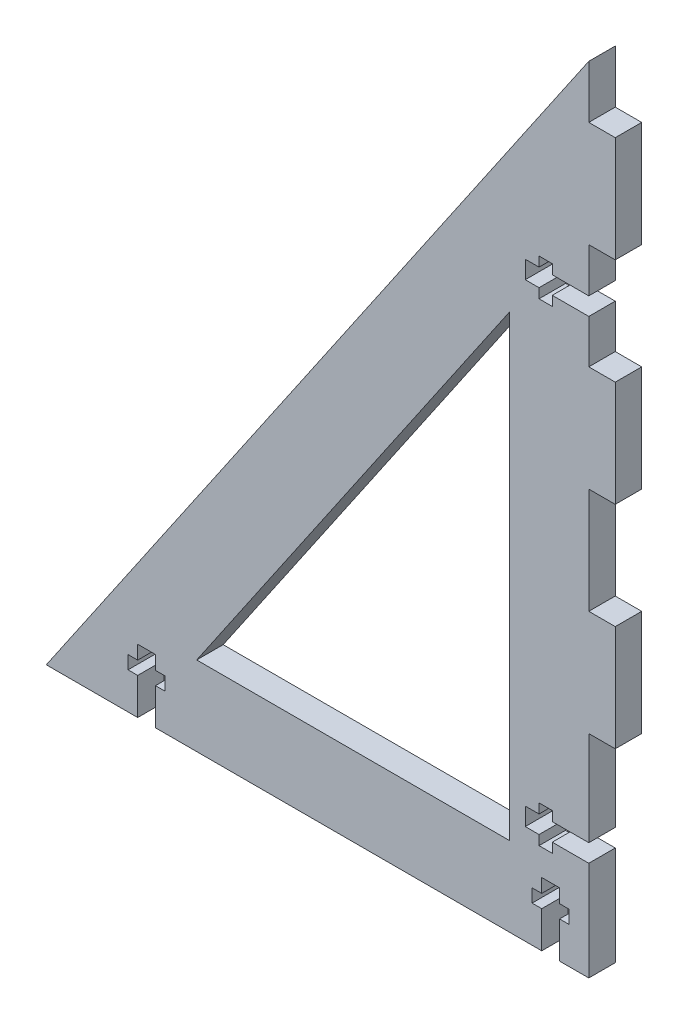
from build123d import *

# Parameters (mm, degrees)
BOSS_EXTRUDE1_DEPTH = 3.175
CUT_EXTRUDE1_DEPTH  = 295.23189409
CUT_EXTRUDE2_DEPTH  = 6.35
SKETCH4_W           = 6.35
SKETCH4_H           = 25.4
BOSS_EXTRUDE2_DEPTH = 6.35
LPATTERN1_COUNT     = 3
LPATTERN1_PITCH     = 50.8


with BuildPart() as part:
    # Sketch1 → Boss-Extrude1 (new, symmetric)
    with BuildSketch(Plane.XY):
        Polygon((69.85, 285.75), (69.85, 95.25), (-60.325, 95.25), align=None)
    extrude(amount=BOSS_EXTRUDE1_DEPTH, both=True)

    # Sketch2 → Cut-Extrude1 (cut, through all)
    with BuildSketch(Plane.XY.offset(3.175)):
        Polygon((-24.23461968, 114.3), (50.8, 114.3), (50.8, 224.106760508), align=None)
    extrude(amount=-CUT_EXTRUDE1_DEPTH, mode=Mode.SUBTRACT)

    # Sketch3 → Cut-Extrude2 (cut)
    with BuildSketch(Plane(origin=(0, 0, -3.175), x_dir=(-1, 0, 0), z_dir=(0, 0, -1))):
        Polygon((-62.827867951, 95.25), (-58.560667951, 95.25), (-58.560667951, 104.013), (-56.249267951, 104.013), (-56.249267951, 107.188), (-58.560667951, 107.188), (-58.560667951, 110.49), (-62.827867951, 110.49), (-62.827867951, 107.188), (-65.139267951, 107.188), (-65.139267951, 104.013), (-62.827867951, 104.013), align=None)
        Polygon((34.12631176, 95.25), (38.39351176, 95.25), (38.39351176, 104.013), (40.70491176, 104.013), (40.70491176, 107.188), (38.39351176, 107.188), (38.39351176, 110.49), (34.12631176, 110.49), (34.12631176, 107.188), (31.81491176, 107.188), (31.81491176, 104.013), (34.12631176, 104.013), align=None)
        Polygon((-69.85, 237.000618256), (-69.85, 232.733418256), (-61.087, 232.733418256), (-61.087, 230.422018256), (-57.912, 230.422018256), (-57.912, 232.733418256), (-54.61, 232.733418256), (-54.61, 237.000618256), (-57.912, 237.000618256), (-57.912, 239.312018256), (-61.087, 239.312018256), (-61.087, 237.000618256), align=None)
        Polygon((-69.85, 123.363816651), (-69.85, 119.096616651), (-61.087, 119.096616651), (-61.087, 116.785216651), (-57.912, 116.785216651), (-57.912, 119.096616651), (-54.61, 119.096616651), (-54.61, 123.363816651), (-57.912, 123.363816651), (-57.912, 125.675216651), (-61.087, 125.675216651), (-61.087, 123.363816651), align=None)
    extrude(amount=-CUT_EXTRUDE2_DEPTH, mode=Mode.SUBTRACT)

    # Sketch4 → Boss-Extrude2 (add)
    with BuildSketch(Plane(origin=(69.85, 0, 0), x_dir=(0, 0, -1), z_dir=(1, 0, 0))):
        with Locations((0, 260.35)):
            Rectangle(SKETCH4_W, SKETCH4_H)
    boss_extrude2 = extrude(amount=BOSS_EXTRUDE2_DEPTH)

    # LPattern1: Boss-Extrude2 ×3
    with Locations(*[(0, -i * LPATTERN1_PITCH, 0) for i in range(1, LPATTERN1_COUNT)]):
        add(boss_extrude2)


solid = part.part
